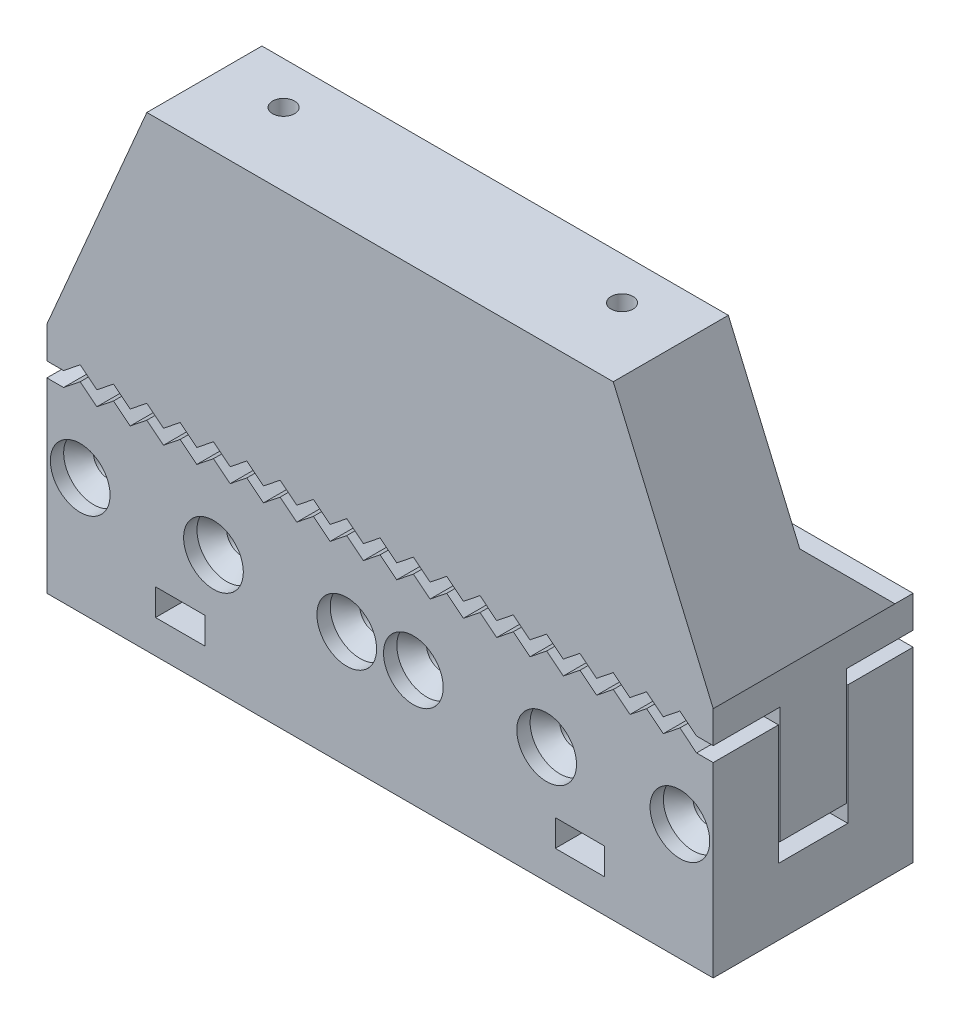
from build123d import *

# Parameters (mm, degrees)
SKETCH1_W                      = 100
SKETCH1_H                      = 30
BOSS_EXTRUDE1_DEPTH            = 30
SKETCH2_W                      = 10.4
SKETCH2_H                      = 20
CUT_EXTRUDE1_DEPTH             = 106.475115549
BOSS_EXTRUDE3_DEPTH            = 100
CUT_EXTRUDE7_DEPTH             = 10
CUT_EXTRUDE8_DEPTH             = 92.104335791
CHAMFER1_SIZE                  = 15
CHAMFER1_SIZE2                 = 35
MIRROR5_START                  = -73.531602401
MIRROR5_OUTLINE_W              = 41
MIRROR5_OUTLINE_H              = 30
MIRROR5_DEPTH                  = 13.78717545
M4X0_7_TAPPED_HOLE1_AT_2_COUNT = 2
M4X0_7_TAPPED_HOLE1_AT_2_PITCH = 50.8
M4X0_7_TAPPED_HOLE2_AT_2_COUNT = 2
M4X0_7_TAPPED_HOLE2_AT_2_PITCH = 60
SKETCH22_W                     = 7.4
SKETCH22_H                     = 4
CUT_EXTRUDE9_DEPTH             = 14
CSK_FOR_M4_SFHCS1_AT_2_COUNT   = 2
CSK_FOR_M4_SFHCS1_AT_2_PITCH   = 20
CSK_FOR_M4_SFHCS1_AT_3_COUNT   = 2
CSK_FOR_M4_SFHCS1_AT_3_PITCH   = 40
CSK_FOR_M4_SFHCS1_AT_4_COUNT   = 2
CSK_FOR_M4_SFHCS1_AT_4_PITCH   = 50
CSK_FOR_M4_SFHCS1_AT_5_COUNT   = 2
CSK_FOR_M4_SFHCS1_AT_5_PITCH   = 70
CSK_FOR_M4_SFHCS1_AT_6_COUNT   = 2
CSK_FOR_M4_SFHCS1_AT_6_PITCH   = 90
CSK_FOR_M4_SFHCS2_AT_2_COUNT   = 2
CSK_FOR_M4_SFHCS2_AT_2_PITCH   = 20
CSK_FOR_M4_SFHCS2_AT_3_COUNT   = 2
CSK_FOR_M4_SFHCS2_AT_3_PITCH   = 40
CSK_FOR_M4_SFHCS2_AT_4_COUNT   = 2
CSK_FOR_M4_SFHCS2_AT_4_PITCH   = 40
CSK_FOR_M4_SFHCS2_AT_5_COUNT   = 2
CSK_FOR_M4_SFHCS2_AT_5_PITCH   = 20
SKETCH30_W                     = 1.65
SKETCH30_H                     = 10
M4X0_7_TAPPED_HOLE3_AT_2_COUNT = 2
M4X0_7_TAPPED_HOLE3_AT_2_PITCH = 15
M4X0_7_TAPPED_HOLE3_AT_3_COUNT = 2
M4X0_7_TAPPED_HOLE3_AT_3_PITCH = 30
M4X0_7_TAPPED_HOLE3_AT_4_COUNT = 2
M4X0_7_TAPPED_HOLE3_AT_4_PITCH = 45
M4X0_7_TAPPED_HOLE3_AT_5_COUNT = 2
M4X0_7_TAPPED_HOLE3_AT_5_PITCH = 60
M4X0_7_TAPPED_HOLE3_AT_6_COUNT = 2
M4X0_7_TAPPED_HOLE3_AT_6_PITCH = 75
M4X0_7_TAPPED_HOLE3_AT_7_COUNT = 2
M4X0_7_TAPPED_HOLE3_AT_7_PITCH = 90
SKETCH31_W                     = 12.728
SKETCH31_H                     = 35
CUT_EXTRUDE10_DEPTH            = 123.983738762
CHAMFER2_SIZE                  = 10


# Read off the part's stored shape, not the designer's step: Mirror5
with BuildPart() as part:
    # Sketch1 → Boss-Extrude1 (new body)
    with BuildSketch(Plane(origin=(0, 0, 0), x_dir=(1, 0, 0), z_dir=(0, 1, 0))):
        Rectangle(SKETCH1_W, SKETCH1_H)
    extrude(amount=BOSS_EXTRUDE1_DEPTH)

    # Sketch2 → Cut-Extrude1 (cut, through all)
    with BuildSketch(Plane.ZY.offset(50)):
        with Locations((0, 20)):
            Rectangle(SKETCH2_W, SKETCH2_H)
    extrude(amount=-CUT_EXTRUDE1_DEPTH, mode=Mode.SUBTRACT)

    # Sketch11 → Cut-Extrude8 (cut, through all)
    with BuildSketch(Plane(origin=(0, 0, -15), x_dir=(-1, 0, 0), z_dir=(0, 0, -1))):
        Polygon((-50, 30), (-50, 28), (-47.5, 28), (-45, 30), align=None)
        Polygon((-40, 30), (-45, 30), (-42.5, 28), align=None)
        Polygon((-35, 30), (-40, 30), (-37.5, 28), align=None)
        Polygon((-30, 30), (-35, 30), (-32.5, 28), align=None)
        Polygon((-20, 30), (-25, 30), (-22.5, 28), align=None)
        Polygon((-15, 30), (-20, 30), (-17.5, 28), align=None)
        Polygon((-25, 30), (-30, 30), (-27.5, 28), align=None)
        Polygon((-10, 30), (-15, 30), (-12.5, 28), align=None)
        Polygon((-5, 30), (-10, 30), (-7.5, 28), align=None)
        Polygon((0, 30), (-5, 30), (-2.5, 28), align=None)
        Polygon((2.5, 28), (5, 30), (0, 30), align=None)
        Polygon((7.5, 28), (10, 30), (5, 30), align=None)
        Polygon((12.5, 28), (15, 30), (10, 30), align=None)
        Polygon((17.5, 28), (20, 30), (15, 30), align=None)
        Polygon((22.5, 28), (25, 30), (20, 30), align=None)
        Polygon((27.5, 28), (30, 30), (25, 30), align=None)
        Polygon((32.5, 28), (35, 30), (30, 30), align=None)
        Polygon((37.5, 28), (40, 30), (35, 30), align=None)
        Polygon((42.5, 28), (45, 30), (40, 30), align=None)
        Polygon((47.5, 28), (50, 28), (50, 30), (45, 30), align=None)
    extrude(amount=-CUT_EXTRUDE8_DEPTH, mode=Mode.SUBTRACT)

    # Sketch21 → M4x0.7 Tapped Hole2 (revolve, cut)
    with BuildSketch(Plane(origin=(30, 0, -5), x_dir=(0, 0, -1), z_dir=(1, 0, 0))):
        Polygon((0, 0), (0, 9), (1.65, 8.008579979), (1.65, 0), align=None)
    m4x0_7_tapped_hole2 = revolve(axis=Axis((30, -6.35, -5), (0, 1, 0)), mode=Mode.SUBTRACT)

    # M4x0.7 Tapped Hole2 at 2: M4x0.7 Tapped Hole2 ×2
    with Locations(*[(-i * M4X0_7_TAPPED_HOLE2_AT_2_PITCH, 0, 0) for i in range(1, M4X0_7_TAPPED_HOLE2_AT_2_COUNT)]):
        add(m4x0_7_tapped_hole2, mode=Mode.SUBTRACT)

    # Sketch22 → Cut-Extrude9 (cut)
    with BuildSketch(Plane.XY.offset(15)):
        with Locations((30, 7)):
            Rectangle(SKETCH22_W, SKETCH22_H)
    cut_extrude9 = extrude(amount=-CUT_EXTRUDE9_DEPTH, mode=Mode.SUBTRACT)

    # Mirror6: Cut-Extrude9 across plane
    add(cut_extrude9.mirror(Plane(origin=(0, 0, 0), x_dir=(0, 0, 1), z_dir=(1, 0, 0))), mode=Mode.SUBTRACT)

    # Sketch25 → CSK for M4 SFHCS1 (revolve, cut)
    with BuildSketch(Plane(origin=(-45, 17.5, 15), x_dir=(0, -1, 0), z_dir=(1, 0, 0))):
        Polygon((0, 0), (0, 20), (2.25, 20), (2.25, 4.23), (4.48, 2), (4.48, 0), align=None)
    csk_for_m4_sfhcs1 = revolve(axis=Axis((-45, 17.5, 21.35), (0, 0, -1)), mode=Mode.SUBTRACT)

    # CSK for M4 SFHCS1 at 2: CSK for M4 SFHCS1 ×2
    with Locations(*[(i * CSK_FOR_M4_SFHCS1_AT_2_PITCH, 0, 0) for i in range(1, CSK_FOR_M4_SFHCS1_AT_2_COUNT)]):
        add(csk_for_m4_sfhcs1, mode=Mode.SUBTRACT)

    # CSK for M4 SFHCS1 at 3: CSK for M4 SFHCS1 ×2
    with Locations(*[(i * CSK_FOR_M4_SFHCS1_AT_3_PITCH, 0, 0) for i in range(1, CSK_FOR_M4_SFHCS1_AT_3_COUNT)]):
        add(csk_for_m4_sfhcs1, mode=Mode.SUBTRACT)

    # CSK for M4 SFHCS1 at 4: CSK for M4 SFHCS1 ×2
    with Locations(*[(i * CSK_FOR_M4_SFHCS1_AT_4_PITCH, 0, 0) for i in range(1, CSK_FOR_M4_SFHCS1_AT_4_COUNT)]):
        add(csk_for_m4_sfhcs1, mode=Mode.SUBTRACT)

    # CSK for M4 SFHCS1 at 5: CSK for M4 SFHCS1 ×2
    with Locations(*[(i * CSK_FOR_M4_SFHCS1_AT_5_PITCH, 0, 0) for i in range(1, CSK_FOR_M4_SFHCS1_AT_5_COUNT)]):
        add(csk_for_m4_sfhcs1, mode=Mode.SUBTRACT)

    # CSK for M4 SFHCS1 at 6: CSK for M4 SFHCS1 ×2
    with Locations(*[(i * CSK_FOR_M4_SFHCS1_AT_6_PITCH, 0, 0) for i in range(1, CSK_FOR_M4_SFHCS1_AT_6_COUNT)]):
        add(csk_for_m4_sfhcs1, mode=Mode.SUBTRACT)

    # Sketch27 → CSK for M4 SFHCS2 (revolve, cut)
    with BuildSketch(Plane(origin=(0, 17.5, -15), x_dir=(0, 1, 0), z_dir=(1, 0, 0))):
        Polygon((0, 0), (0, 20), (2.25, 20), (2.25, 4.23), (4.48, 2), (4.48, 0), align=None)
    csk_for_m4_sfhcs2 = revolve(axis=Axis((0, 17.5, -21.35), (0, 0, 1)), mode=Mode.SUBTRACT)

    # CSK for M4 SFHCS2 at 2: CSK for M4 SFHCS2 ×2
    with Locations(*[(i * CSK_FOR_M4_SFHCS2_AT_2_PITCH, 0, 0) for i in range(1, CSK_FOR_M4_SFHCS2_AT_2_COUNT)]):
        add(csk_for_m4_sfhcs2, mode=Mode.SUBTRACT)

    # CSK for M4 SFHCS2 at 3: CSK for M4 SFHCS2 ×2
    with Locations(*[(i * CSK_FOR_M4_SFHCS2_AT_3_PITCH, 0, 0) for i in range(1, CSK_FOR_M4_SFHCS2_AT_3_COUNT)]):
        add(csk_for_m4_sfhcs2, mode=Mode.SUBTRACT)

    # CSK for M4 SFHCS2 at 4: CSK for M4 SFHCS2 ×2
    with Locations(*[(-i * CSK_FOR_M4_SFHCS2_AT_4_PITCH, 0, 0) for i in range(1, CSK_FOR_M4_SFHCS2_AT_4_COUNT)]):
        add(csk_for_m4_sfhcs2, mode=Mode.SUBTRACT)

    # CSK for M4 SFHCS2 at 5: CSK for M4 SFHCS2 ×2
    with Locations(*[(-i * CSK_FOR_M4_SFHCS2_AT_5_PITCH, 0, 0) for i in range(1, CSK_FOR_M4_SFHCS2_AT_5_COUNT)]):
        add(csk_for_m4_sfhcs2, mode=Mode.SUBTRACT)


with BuildPart() as body_2:
    # Sketch8 → Boss-Extrude3 (new body)
    with BuildSketch(Plane.ZY.offset(50)):
        Polygon((5, 30.2), (15, 30.2), (15, 70), (-15, 70), (-15, 30.2), (-5, 30.2), (-5, 12.7), (5, 12.7), align=None)
    extrude(amount=-BOSS_EXTRUDE3_DEPTH)

    # Sketch10 → Cut-Extrude7 (cut)
    with BuildSketch(Plane(origin=(0, 0, -15), x_dir=(-1, 0, 0), z_dir=(0, 0, -1))):
        Polygon((-45, 32.2), (-47.5, 30.2), (-42.5, 30.2), align=None)
        Polygon((-40, 32.2), (-42.5, 30.2), (-37.5, 30.2), align=None)
        Polygon((-35, 32.2), (-37.5, 30.2), (-32.5, 30.2), align=None)
        Polygon((-30, 32.2), (-32.5, 30.2), (-27.5, 30.2), align=None)
        Polygon((-25, 32.2), (-27.5, 30.2), (-22.5, 30.2), align=None)
        Polygon((-20, 32.2), (-22.5, 30.2), (-17.5, 30.2), align=None)
        Polygon((-15, 32.2), (-17.5, 30.2), (-12.5, 30.2), align=None)
        Polygon((-10, 32.2), (-12.5, 30.2), (-7.5, 30.2), align=None)
        Polygon((-7.5, 30.2), (-2.5, 30.2), (-5, 32.2), align=None)
        Polygon((-2.5, 30.2), (2.5, 30.2), (0, 32.2), align=None)
        Polygon((2.5, 30.2), (7.5, 30.2), (5, 32.2), align=None)
        Polygon((7.5, 30.2), (12.5, 30.2), (10, 32.2), align=None)
        Polygon((12.5, 30.2), (17.5, 30.2), (15, 32.2), align=None)
        Polygon((17.5, 30.2), (22.5, 30.2), (20, 32.2), align=None)
        Polygon((22.5, 30.2), (27.5, 30.2), (25, 32.2), align=None)
        Polygon((27.5, 30.2), (32.5, 30.2), (30, 32.2), align=None)
        Polygon((32.5, 30.2), (37.5, 30.2), (35, 32.2), align=None)
        Polygon((37.5, 30.2), (42.5, 30.2), (40, 32.2), align=None)
        Polygon((42.5, 30.2), (47.5, 30.2), (45, 32.2), align=None)
    cut_extrude7 = extrude(amount=-CUT_EXTRUDE7_DEPTH, mode=Mode.SUBTRACT)

    # Mirror2: Cut-Extrude7 across plane
    add(cut_extrude7.mirror(Plane.XY), mode=Mode.SUBTRACT)

    # Chamfer1
    chamfer1_edges = [body_2.edges().sort_by_distance(p)[0] for p in [
        (50, 70, 0),
    ]]
    chamfer1_side = [body_2.faces().sort_by_distance(p)[0] for p in [
        (0, 70, 0),
    ]]
    chamfer(chamfer1_edges, length=CHAMFER1_SIZE, length2=CHAMFER1_SIZE2, reference=chamfer1_side[0])

    # Mirror5 outline → Mirror5 (cut)
    with BuildSketch(Plane(origin=(0, 0, 0), x_dir=(0.3939192985791651, 0.919145030018059, 0), z_dir=(0.919145030018059, -0.393919298579165, 0)).offset(MIRROR5_START)):
        with Locations((31.5, 0)):
            Rectangle(MIRROR5_OUTLINE_W, MIRROR5_OUTLINE_H)
    extrude(amount=MIRROR5_DEPTH, mode=Mode.SUBTRACT)

    # Sketch18 → M4x0.7 Tapped Hole1 (revolve, cut)
    with BuildSketch(Plane(origin=(-25.4, 70, 4.078), x_dir=(0, 0, 1), z_dir=(1, 0, 0))):
        Polygon((0, 0), (0, 12), (1.65, 11.008579979), (1.65, 0), align=None)
    m4x0_7_tapped_hole1 = revolve(axis=Axis((-25.4, 76.35, 4.078), (0, -1, 0)), mode=Mode.SUBTRACT)

    # M4x0.7 Tapped Hole1 at 2: M4x0.7 Tapped Hole1 ×2
    with Locations(*[(i * M4X0_7_TAPPED_HOLE1_AT_2_PITCH, 0, 0) for i in range(1, M4X0_7_TAPPED_HOLE1_AT_2_COUNT)]):
        add(m4x0_7_tapped_hole1, mode=Mode.SUBTRACT)

    # Sketch30 → M4x0.7 Tapped Hole3 (revolve, cut)
    with BuildSketch(Plane(origin=(-45, 19.7, 5), x_dir=(0, -1, 0), z_dir=(1, 0, 0))):
        with Locations((0.825, 5)):
            Rectangle(SKETCH30_W, SKETCH30_H)
    m4x0_7_tapped_hole3 = revolve(axis=Axis((-45, 19.7, 11.35), (0, 0, -1)), mode=Mode.SUBTRACT)

    # M4x0.7 Tapped Hole3 at 2: M4x0.7 Tapped Hole3 ×2
    with Locations(*[(i * M4X0_7_TAPPED_HOLE3_AT_2_PITCH, 0, 0) for i in range(1, M4X0_7_TAPPED_HOLE3_AT_2_COUNT)]):
        add(m4x0_7_tapped_hole3, mode=Mode.SUBTRACT)

    # M4x0.7 Tapped Hole3 at 3: M4x0.7 Tapped Hole3 ×2
    with Locations(*[(i * M4X0_7_TAPPED_HOLE3_AT_3_PITCH, 0, 0) for i in range(1, M4X0_7_TAPPED_HOLE3_AT_3_COUNT)]):
        add(m4x0_7_tapped_hole3, mode=Mode.SUBTRACT)

    # M4x0.7 Tapped Hole3 at 4: M4x0.7 Tapped Hole3 ×2
    with Locations(*[(i * M4X0_7_TAPPED_HOLE3_AT_4_PITCH, 0, 0) for i in range(1, M4X0_7_TAPPED_HOLE3_AT_4_COUNT)]):
        add(m4x0_7_tapped_hole3, mode=Mode.SUBTRACT)

    # M4x0.7 Tapped Hole3 at 5: M4x0.7 Tapped Hole3 ×2
    with Locations(*[(i * M4X0_7_TAPPED_HOLE3_AT_5_PITCH, 0, 0) for i in range(1, M4X0_7_TAPPED_HOLE3_AT_5_COUNT)]):
        add(m4x0_7_tapped_hole3, mode=Mode.SUBTRACT)

    # M4x0.7 Tapped Hole3 at 6: M4x0.7 Tapped Hole3 ×2
    with Locations(*[(i * M4X0_7_TAPPED_HOLE3_AT_6_PITCH, 0, 0) for i in range(1, M4X0_7_TAPPED_HOLE3_AT_6_COUNT)]):
        add(m4x0_7_tapped_hole3, mode=Mode.SUBTRACT)

    # M4x0.7 Tapped Hole3 at 7: M4x0.7 Tapped Hole3 ×2
    with Locations(*[(i * M4X0_7_TAPPED_HOLE3_AT_7_PITCH, 0, 0) for i in range(1, M4X0_7_TAPPED_HOLE3_AT_7_COUNT)]):
        add(m4x0_7_tapped_hole3, mode=Mode.SUBTRACT)

    # Sketch31 → Cut-Extrude10 (cut, through all)
    with BuildSketch(Plane(origin=(50, 0, 0), x_dir=(0, 0, -1), z_dir=(1, 0, 0))):
        with Locations((8.636, 52.5)):
            Rectangle(SKETCH31_W, SKETCH31_H)
    extrude(amount=-CUT_EXTRUDE10_DEPTH, mode=Mode.SUBTRACT)

    # Chamfer2
    chamfer2_edges = [body_2.edges().sort_by_distance(p)[0] for p in [
        (0, 35, -2.272),
    ]]
    chamfer(chamfer2_edges, length=CHAMFER2_SIZE)


solid = Compound([part.part, body_2.part])
